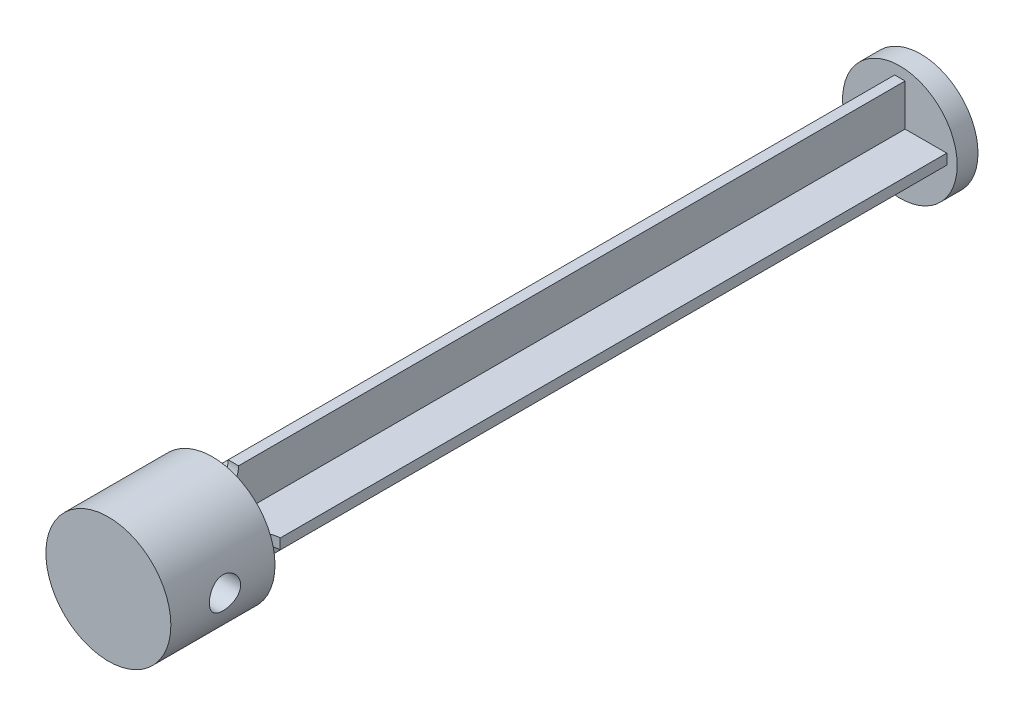
from build123d import *

# Parameters (mm, degrees)
SKETCH1_R               = 6.985
BOSS_EXTRUDE1_DEPTH     = 2.54
BOSS_EXTRUDE2_DEPTH     = 81.28
BOSS_EXTRUDE3_DEPTH     = 2.54
FILLET1_R               = 2.54
SKETCH4_R               = 7.62
BOSS_EXTRUDE4_DEPTH     = 12.7
CUT_EXTRUDE1_DEPTH      = 101.243554531
CUT_EXTRUDE1_DEPTH_BACK = 101.243554531
SKETCH5_R               = 1.905


with BuildPart() as part:
    # Sketch1 → Boss-Extrude1 (new body)
    with BuildSketch(Plane.XY):
        Circle(SKETCH1_R)
    extrude(amount=BOSS_EXTRUDE1_DEPTH)

    # Sketch2 → Boss-Extrude2 (add)
    with BuildSketch(Plane.XY.offset(2.54)):
        Polygon((-0.635, -0.635), (-5.715, -0.635), (-5.715, 0.635), (-0.635, 0.635), (-0.635, 5.715), (0.635, 5.715), (0.635, 0.635), (5.715, 0.635), (5.715, -0.635), (0.635, -0.635), (0.635, -5.715), (-0.635, -5.715), align=None)
    extrude(amount=BOSS_EXTRUDE2_DEPTH)

    # Sketch3 → Boss-Extrude3 (add)
    with BuildSketch(Plane.XY.offset(83.82)):
        Polygon((-3.175, 0.635), (-0.635, 0.635), (-0.635, 3.175), (0.635, 3.175), (0.635, 0.635), (3.175, 0.635), (3.175, -0.635), (0.635, -0.635), (0.635, -3.175), (-0.635, -3.175), (-0.635, -0.635), (-3.175, -0.635), align=None)
    extrude(amount=BOSS_EXTRUDE3_DEPTH)

    # Fillet1
    fillet1_edges = [part.edges().sort_by_distance(p)[0] for p in [
        (0, -3.175, 83.82),
        (3.175, 0, 83.82),
        (0, 3.175, 83.82),
        (-3.175, 0, 83.82),
    ]]
    fillet(fillet1_edges, radius=FILLET1_R - 0.0001)  # a hair under: the kernel refuses the full size

    # Sketch4 → Boss-Extrude4 (add)
    with BuildSketch(Plane.XY.offset(86.36)):
        Circle(SKETCH4_R)
    extrude(amount=BOSS_EXTRUDE4_DEPTH)

    # Sketch5 → Cut-Extrude1 (cut, two sides: drawn at the far end of the back side and taken through both)
    with BuildSketch(Plane(origin=(5.715, 0, 0), x_dir=(0, 0, -1), z_dir=(1, 0, 0)).offset(-CUT_EXTRUDE1_DEPTH_BACK)):
        with Locations(Location((-92.458470984, 0, 0), (0, 0, 180.000000004))):
            Circle(SKETCH5_R)
    extrude(amount=CUT_EXTRUDE1_DEPTH + CUT_EXTRUDE1_DEPTH_BACK, mode=Mode.SUBTRACT)


solid = part.part
